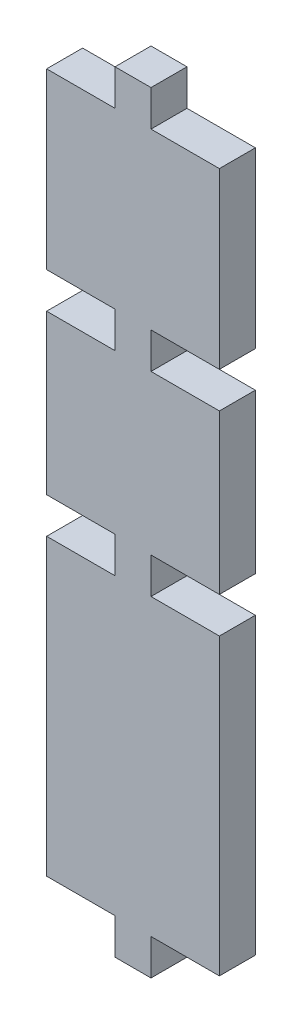
from build123d import *

# Parameters (mm, degrees)
BOSS_EXTRUDE1_DEPTH = 1.524


with BuildPart() as part:
    # Sketch1 → Boss-Extrude1 (new body)
    with BuildSketch(Plane.XY):
        Polygon((4.271141743, -1.524), (4.271141743, 0), (1.374376796, 0), (1.374376796, 6.732723008), (4.271141743, 6.732723008), (4.271141743, 8.256723008), (1.374376796, 8.256723008), (1.374376796, 15.622723008), (4.271141743, 15.622723008), (4.271141743, 17.146723008), (5.795141743, 17.146723008), (5.795141743, 15.622723008), (8.691906689, 15.622723008), (8.691906689, 8.256723008), (5.795141743, 8.256723008), (5.795141743, 6.732723008), (8.691906689, 6.732723008), (8.691906689, 0), (5.795141743, 0), (5.795141743, -1.524), (8.691906689, -1.524), (8.691906689, -13.993497683), (5.795141743, -13.993497683), (5.795141743, -15.517497683), (4.271141743, -15.517497683), (4.271141743, -13.993497683), (1.374376796, -13.993497683), (1.374376796, -1.524), align=None)
    extrude(amount=BOSS_EXTRUDE1_DEPTH)


solid = part.part
